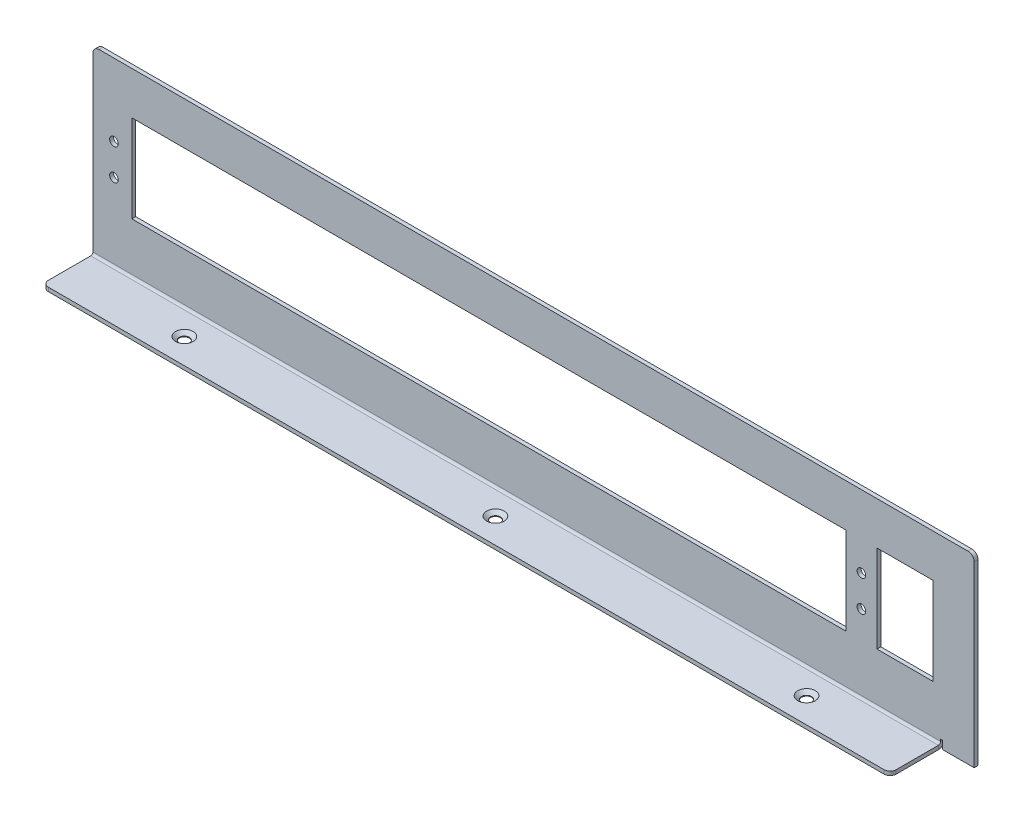
from build123d import *

# Parameters (mm, degrees)
SKETCH2_W                     = 287.78
SKETCH2_H                     = 60.27
SKETCH2_W_2                   = 233.19
SKETCH2_H_2                   = 28.58
SKETCH2_W_3                   = 18.27
BASE_FLANGE1_DEPTH            = 1.27
EDGE_FLANGE1_STRIP_W          = 6.5532
EDGE_FLANGE1_STRIP_H          = 1.27
EDGE_FLANGE1_STRIP_CUT_DEPTH  = 276.86
EDGE_FLANGE1_RELIEF_W         = 7.1882
EDGE_FLANGE1_RELIEF_H         = 0.635
EDGE_FLANGE1_RELIEF_CUT_DEPTH = 1.27
EDGE_FLANGE1_DEPTH            = 276.86
F_34_0_111_DIAMETER_HOLE1_D   = 2.8194
LPATTERN1_COUNT               = 3
LPATTERN1_PITCH               = 101.6
FILLET1_R                     = 2


# Sheet-metal steps are written as plain solids
with BuildPart() as part:
    # Sketch2 → Base-Flange1 (new body)
    with BuildSketch(Plane.XY):
        Rectangle(SKETCH2_W, SKETCH2_H)
        with Locations((-14.595, 1.875)):
            Rectangle(SKETCH2_W_2, SKETCH2_H_2, mode=Mode.SUBTRACT)
        with Locations((121.295, 1.875)):
            Rectangle(SKETCH2_W_3, SKETCH2_H_2, mode=Mode.SUBTRACT)
    extrude(amount=-BASE_FLANGE1_DEPTH)

    # Edge-Flange1 strip (across the edge) → Edge-Flange1 strip cut (cut)
    with BuildSketch(Plane(origin=(-143.89, -30.135, 0), x_dir=(0, 1, 0), z_dir=(1, 0, 0))):
        with Locations((-1.27, -0.635)):
            Rectangle(EDGE_FLANGE1_STRIP_W, EDGE_FLANGE1_STRIP_H)
    extrude(amount=EDGE_FLANGE1_STRIP_CUT_DEPTH, mode=Mode.SUBTRACT)

    # Edge-Flange1 relief (on the sheet) → Edge-Flange1 relief cut (cut)
    with BuildSketch(Plane(origin=(-143.89, -28.1284, 0), x_dir=(0, 1, 0), z_dir=(0, 0, 1))):
        with Locations((-2.9591, -277.1775)):
            Rectangle(EDGE_FLANGE1_RELIEF_W, EDGE_FLANGE1_RELIEF_H)
    extrude(amount=-EDGE_FLANGE1_RELIEF_CUT_DEPTH, mode=Mode.SUBTRACT)

    # Edge-Flange1 section (across the edge) → Edge-Flange1 (add)
    with BuildSketch(Plane(origin=(-143.89, -30.135, 0), x_dir=(0, 1, 0), z_dir=(1, 0, 0))):
        with BuildLine():
            Line((0, 0.7366), (0, 16.51))
            Line((0, 16.51), (1.27, 16.51))
            Line((1.27, 16.51), (1.27, 0.7366))
            ThreePointArc((1.27, 0.7366), (1.485745145, 0.215745145), (2.0066, 0))
            Line((2.0066, 0), (2.0066, -1.27))
            ThreePointArc((2.0066, -1.27), (0.587719533, -0.682280467), (0, 0.7366))
        make_face()
    extrude(amount=EDGE_FLANGE1_DEPTH)

    # #34 (0.111) Diameter Hole1 (through all)
    with Locations(Plane.XY):
        with Locations((-137.03, 6.535), (-137.03, -3.625), (107.08, 6.535), (107.08, -3.625)):
            Hole(F_34_0_111_DIAMETER_HOLE1_D / 2)

    # Sketch13 → CSK for #4 Flat Head Machine Screw (100)1 (revolve, cut)
    with BuildSketch(Plane(origin=(97.41, -28.865, 8.25), x_dir=(0, 0, 1), z_dir=(1, 0, 0))):
        Polygon((0, 0), (0, 1.27), (1.63195, 1.27), (1.63195, 1.028358553), (2.8575, 0), align=None)
    csk_for_4_flat_head_machine_screw_100 = revolve(axis=Axis((97.41, -22.515, 8.25), (0, -1, 0)), mode=Mode.SUBTRACT)

    # LPattern1: CSK for #4 Flat Head Machine Screw (100)1 ×3
    with Locations(*[(-i * LPATTERN1_PITCH, 0, 0) for i in range(1, LPATTERN1_COUNT)]):
        add(csk_for_4_flat_head_machine_screw_100, mode=Mode.SUBTRACT)

    # Fillet1
    fillet1_edges = [part.edges().sort_by_distance(p)[0] for p in [
        (-143.89, -29.5, 16.51),
        (132.97, -29.5, 16.51),
        (-143.89, 30.135, -0.635),
        (143.89, 30.135, -0.635),
    ]]
    fillet(fillet1_edges, radius=FILLET1_R)


solid = part.part
